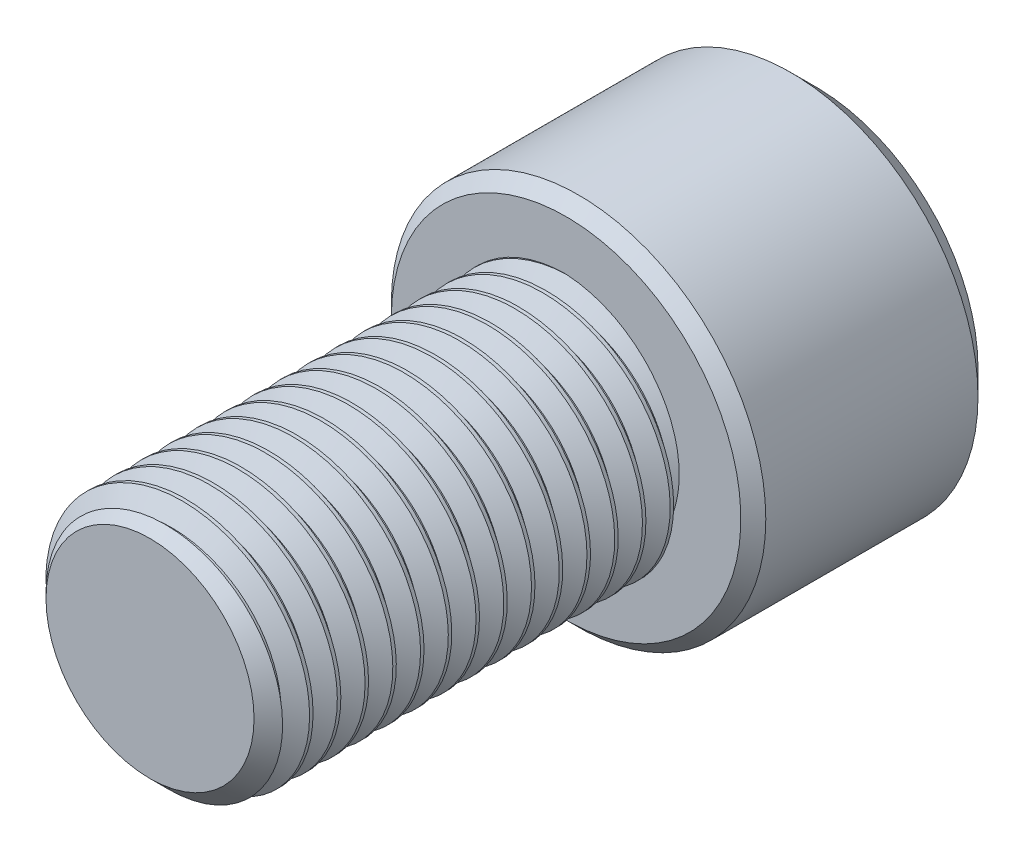
from build123d import *

# Parameters (mm, degrees)
SKETCH1_R          = 4.7625
EXTRUDE1_DEPTH     = 15.875
CHAMFER3_SIZE      = 0.79375
CUT_SWEEP1_PITCH   = 1.058333333
SKETCH6_R          = 7.14375
EXTRUDE2_DEPTH     = 9.525
CUT_EXTRUDE1_DEPTH = 5.953125
SKETCH8_R          = 4.582717762
CUT_EXTRUDE2_DEPTH = 0.9525
CUT_EXTRUDE2_DRAFT = -45
CHAMFER1_SIZE      = 0.9525
CHAMFER2_SIZE      = 0.47625


with BuildPart() as part:
    # Sketch1 → Extrude1 (new body)
    with BuildSketch(Plane.XY):
        Circle(SKETCH1_R)
    extrude(amount=-EXTRUDE1_DEPTH)

    # Chamfer3
    chamfer3_edges = [part.edges().sort_by_distance(p)[0] for p in [
        (-4.7625, 0, 0),
    ]]
    chamfer(chamfer3_edges, length=CHAMFER3_SIZE)

    # Cut-Sweep1: the profile of Sketch3 profile screwed along a right-hand helix of 16 turns, 6 arcs to a turn; built about Z, then put on its axis
    cut_sweep1_z = Axis((0, 0, 0), (0, 0, 1))
    cut_sweep1_corners = [(4.7628, 0, -0.926214872), (4.075092336, 0, -0.529166667), (4.075092336, 0, -0.396875), (4.7628, 0, 0.000173205)]
    with BuildLine(mode=Mode.PRIVATE) as cut_sweep1_profile:
        Line(cut_sweep1_corners[0], cut_sweep1_corners[1])
        Line(cut_sweep1_corners[1], cut_sweep1_corners[2])
        Line(cut_sweep1_corners[2], cut_sweep1_corners[3])
        Line(cut_sweep1_corners[3], cut_sweep1_corners[0])
    cut_sweep1_cap = Face(cut_sweep1_profile.wire())
    cut_sweep1_turn_angles = [0, 30, 60, 90, 120, 150, 180, 210, 240, 270, 300, 330, 360]
    cut_sweep1_turn_weights = [1, 0.8660254037844387, 1, 0.8660254037844387, 1, 0.8660254037844387, 1, 0.8660254037844387, 1, 0.8660254037844387, 1, 0.8660254037844387, 1]
    cut_sweep1_turn_rails = [Edge.make_bspline([Vector(p[0], p[1], 0).rotate(cut_sweep1_z, cut_sweep1_turn_angles[k]) / cut_sweep1_turn_weights[k] + Vector(0, 0, p[2] + CUT_SWEEP1_PITCH * cut_sweep1_turn_angles[k] / 360) for k in range(13)], [0, 0, 0, 1, 1, 2, 2, 3, 3, 4, 4, 5, 5, 6, 6, 6], 2, cut_sweep1_turn_weights) for p in cut_sweep1_corners]
    cut_sweep1_turn_sides = [Face.make_surface_from_curves(cut_sweep1_turn_rails[p[0]], cut_sweep1_turn_rails[p[1]]) for p in [(0, 1), (1, 2), (2, 3), (3, 0)]]
    cut_sweep1 = Plane(origin=(0, 0, 0), x_dir=(0, 1, 0), z_dir=(0, 0, -1)) * Solid(Shell([*[p.moved(Location((0, 0, CUT_SWEEP1_PITCH * i))) for i in range(16) for p in cut_sweep1_turn_sides], cut_sweep1_cap, cut_sweep1_cap.rotate(cut_sweep1_z, 5760).moved(Location((0, 0, CUT_SWEEP1_PITCH * 5760 / 360)))]))
    add(cut_sweep1, mode=Mode.SUBTRACT)

    # Sketch6 → Extrude2 (add)
    with BuildSketch(Plane(origin=(0, 0, -15.875), x_dir=(-1, 0, 0), z_dir=(0, 0, -1))):
        with Locations(Location((0, 0, 0), (0, 0, 180))):
            Circle(SKETCH6_R)
    extrude(amount=EXTRUDE2_DEPTH)

    # Sketch7 → Cut-Extrude1 (cut)
    with BuildSketch(Plane(origin=(0, 0, -25.4), x_dir=(-1, 0, 0), z_dir=(0, 0, -1))):
        Polygon((0, 4.582717762), (-3.96875, 2.291358881), (-3.96875, -2.291358881), (0, -4.582717762), (3.96875, -2.291358881), (3.96875, 2.291358881), align=None)
    extrude(amount=-CUT_EXTRUDE1_DEPTH, mode=Mode.SUBTRACT)


with BuildPart() as cut_extrude2_tool:
    # Sketch8 → Cut-Extrude2 (with draft: the straight prism first)
    with BuildSketch(Plane(origin=(0, 0, -25.4), x_dir=(-1, 0, 0), z_dir=(0, 0, -1))):
        Circle(SKETCH8_R)
    extrude(amount=-CUT_EXTRUDE2_DEPTH)
    # Cut-Extrude2: the draft: its side faces are tilted about the plane it starts from
    cut_extrude2_sides = [cut_extrude2_tool.faces().sort_by_distance(p)[0] for p in [
        (4.582717762, 0, -24.92375),
    ]]
    draft(cut_extrude2_sides, Plane(origin=(0, 0, -25.4), x_dir=(-1, 0, 0), z_dir=(0, 0, -1)), CUT_EXTRUDE2_DRAFT)


with BuildPart() as part_1:
    add(part.part)

    # Cut-Extrude2: cut by cut_extrude2_tool
    add(cut_extrude2_tool.part, mode=Mode.SUBTRACT)

    # Chamfer1
    chamfer1_edges = [part_1.edges().sort_by_distance(p)[0] for p in [
        (-7.14375, 0, -25.4),
    ]]
    chamfer(chamfer1_edges, length=CHAMFER1_SIZE)

    # Chamfer2
    chamfer2_edges = [part_1.edges().sort_by_distance(p)[0] for p in [
        (-7.14375, 0, -15.875),
    ]]
    chamfer(chamfer2_edges, length=CHAMFER2_SIZE)


solid = part_1.part
